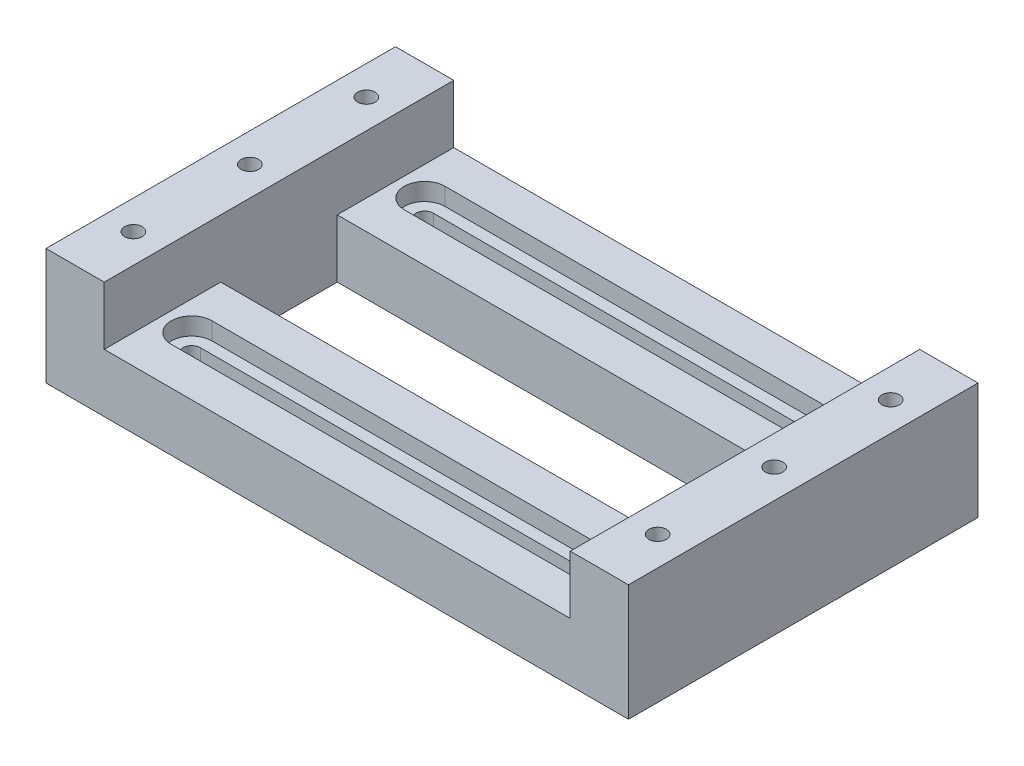
from build123d import *

# Parameters (mm, degrees)
SKETCH1_W             = 100
SKETCH1_H             = 60
SKETCH1_R             = 1.5
SKETCH1_W_2           = 80
SKETCH1_H_2           = 20
BOSS_EXTRUDE1_DEPTH   = 10
CUT_SLOT_INSETS_DEPTH = 3
SKETCH5_R             = 1.5
BOSS_EXTRUDE3_DEPTH   = 10
SKETCH6_R             = 3.75
CUT_EXTRUDE1_DEPTH    = 2.5


with BuildPart() as part:
    # Sketch1 → Boss-Extrude1 (new body)
    with BuildSketch(Plane(origin=(0, 0, 0), x_dir=(1, 0, 0), z_dir=(0, 1, 0))):
        with Locations((50, 30)):
            Rectangle(SKETCH1_W, SKETCH1_H)
        with Locations((5, 10)):
            Circle(SKETCH1_R, mode=Mode.SUBTRACT)
        with BuildLine():
            ThreePointArc((86.5, 10), (86.060660172, 8.939339828), (85, 8.5))
            Line((85, 8.5), (15, 8.5))
            ThreePointArc((15, 8.5), (13.5, 10), (15, 11.5))
            Line((15, 11.5), (85, 11.5))
            ThreePointArc((85, 11.5), (86.060660172, 11.060660172), (86.5, 10))
        make_face(mode=Mode.SUBTRACT)
        with Locations((95, 10)):
            Circle(SKETCH1_R, mode=Mode.SUBTRACT)
        with Locations((50, 30)):
            Rectangle(SKETCH1_W_2, SKETCH1_H_2, mode=Mode.SUBTRACT)
        with Locations((5, 30)):
            Circle(SKETCH1_R, mode=Mode.SUBTRACT)
        with Locations((5, 50)):
            Circle(SKETCH1_R, mode=Mode.SUBTRACT)
        with Locations((95, 30)):
            Circle(SKETCH1_R, mode=Mode.SUBTRACT)
        with BuildLine():
            Line((15, 51.5), (85, 51.5))
            ThreePointArc((85, 51.5), (86.060660172, 51.060660172), (86.5, 50))
            ThreePointArc((86.5, 50), (86.060660172, 48.939339828), (85, 48.5))
            Line((85, 48.5), (15, 48.5))
            ThreePointArc((15, 48.5), (13.5, 50), (15, 51.5))
        make_face(mode=Mode.SUBTRACT)
        with Locations((95, 50)):
            Circle(SKETCH1_R, mode=Mode.SUBTRACT)
    extrude(amount=BOSS_EXTRUDE1_DEPTH)

    # Sketch3 → Cut-Slot insets (cut)
    with BuildSketch(Plane(origin=(0, 10, 0), x_dir=(1, 0, 0), z_dir=(0, 1, 0))):
        with BuildLine():
            Line((15, 46.5), (85, 46.5))
            ThreePointArc((85, 46.5), (88.5, 50), (85, 53.5))
            Line((85, 53.5), (15, 53.5))
            ThreePointArc((15, 53.5), (11.5, 50), (15, 46.5))
        make_face()
        with BuildLine():
            Line((15, 6.5), (85, 6.5))
            ThreePointArc((85, 6.5), (88.5, 10), (85, 13.5))
            Line((85, 13.5), (15, 13.5))
            ThreePointArc((15, 13.5), (11.5, 10), (15, 6.5))
        make_face()
    extrude(amount=-CUT_SLOT_INSETS_DEPTH, mode=Mode.SUBTRACT)

    # Sketch5 → Boss-Extrude3 (add)
    # profile 1 of 2: a face of its own
    with BuildSketch(Plane(origin=(0, 10, 0), x_dir=(1, 0, 0), z_dir=(0, 1, 0))):
        Polygon((10, 20), (10, 40), (10, 60), (0, 60), (0, 0), (10, 0), align=None)
        with Locations((5, 10)):
            Circle(SKETCH5_R, mode=Mode.SUBTRACT)
        with Locations((5, 30)):
            Circle(SKETCH5_R, mode=Mode.SUBTRACT)
        with Locations((5, 50)):
            Circle(SKETCH5_R, mode=Mode.SUBTRACT)
    # profile 2 of 2: a face of its own
    with BuildSketch(Plane(origin=(0, 10, 0), x_dir=(1, 0, 0), z_dir=(0, 1, 0))):
        Polygon((90, 20), (90, 0), (100, 0), (100, 60), (90, 60), (90, 40), align=None)
        with Locations((95, 50)):
            Circle(SKETCH5_R, mode=Mode.SUBTRACT)
        with Locations((95, 30)):
            Circle(SKETCH5_R, mode=Mode.SUBTRACT)
        with Locations((95, 10)):
            Circle(SKETCH5_R, mode=Mode.SUBTRACT)
    extrude(amount=BOSS_EXTRUDE3_DEPTH)

    # Sketch6 → Cut-Extrude1 (cut)
    with BuildSketch(Plane.XZ):
        with Locations((5, -50)):
            Circle(SKETCH6_R)
        with Locations((5, -30)):
            Circle(SKETCH6_R)
        with Locations((5, -10)):
            Circle(SKETCH6_R)
        with Locations((95, -10)):
            Circle(SKETCH6_R)
        with Locations((95, -30)):
            Circle(SKETCH6_R)
        with Locations((95, -50)):
            Circle(SKETCH6_R)
    extrude(amount=-CUT_EXTRUDE1_DEPTH, mode=Mode.SUBTRACT)


solid = part.part
